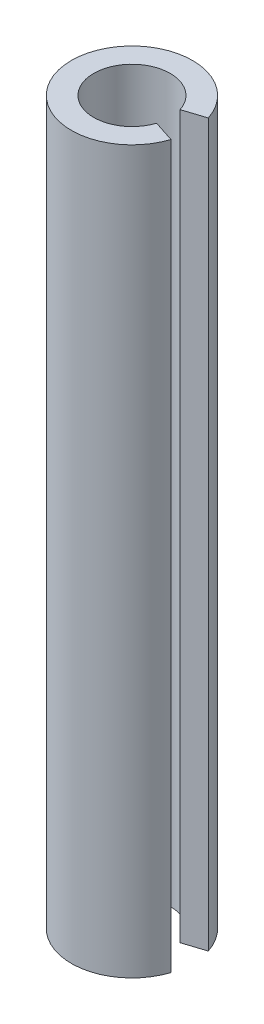
from build123d import *

# Parameters (mm, degrees)
BASE_FLANGE1_DEPTH = 38.7


# Sheet-metal steps are written as plain solids
with BuildPart() as part:
    # Sketch1 → Base-Flange1 (new body)
    with BuildSketch(Plane(origin=(0, 0, 0), x_dir=(1, 0, 0), z_dir=(0, 1, 0))):
        with BuildLine():
            ThreePointArc((3.092329219, 1), (-3.25, 0), (3.092329219, -1))
            Line((3.092329219, -1), (1.950546123, -0.630769231))
            ThreePointArc((1.950546123, -0.630769231), (-2.05, 0), (1.950546123, 0.630769231))
            Line((1.950546123, 0.630769231), (3.092329219, 1))
        make_face()
    extrude(amount=BASE_FLANGE1_DEPTH)


solid = part.part
